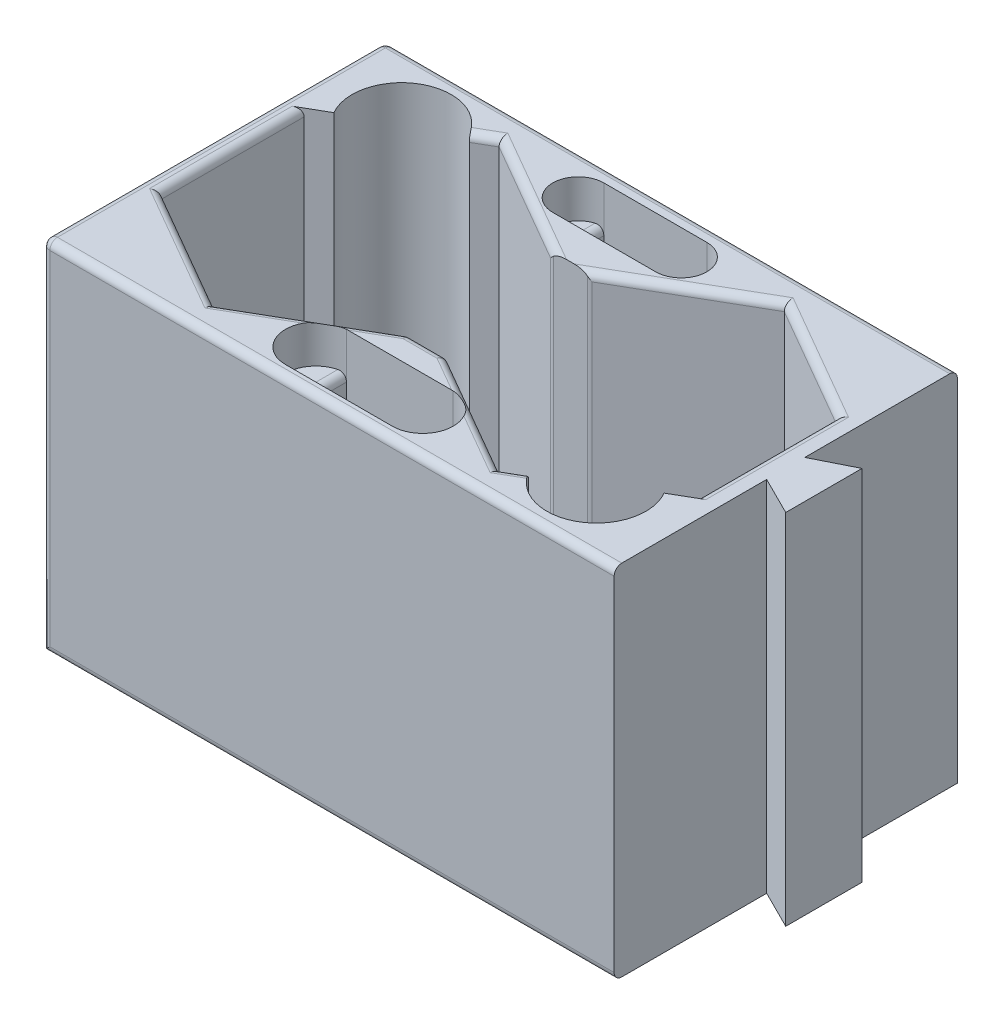
from build123d import *

# Parameters (mm, degrees)
BOSS_EXTRUDE1_DEPTH = 119.38
CUT_EXTRUDE1_DEPTH  = 115.57
SKETCH3_W           = 34.29
SKETCH3_H           = 17.018
CUT_EXTRUDE2_DEPTH  = 20.32
SKETCH4_W           = 35.56
SKETCH4_H           = 20.32
CUT_EXTRUDE3_DEPTH  = 35.56
CUT_EXTRUDE4_DEPTH  = 12.7
FILLET1_R           = 2.54
FILLET2_R           = 2.54


with BuildPart() as part:
    # Sketch1 → Boss-Extrude1 (new body)
    with BuildSketch(Plane(origin=(0, 0, 0), x_dir=(1, 0, 0), z_dir=(0, 1, 0))):
        Polygon((190.5, 63.5), (203.2, 69.85), (203.2, 44.45), (190.5, 50.8), (190.5, 0), (0, 0), (0, 114.3), (190.5, 114.3), align=None)
    extrude(amount=BOSS_EXTRUDE1_DEPTH)

    # Sketch2 → Cut-Extrude1 (cut)
    with BuildSketch(Plane(origin=(0, 119.38, 0), x_dir=(1, 0, 0), z_dir=(0, 1, 0))):
        with BuildLine():
            Line((47.498, 9.636382247), (88.646, 33.393191123))
            Line((88.646, 33.393191123), (101.346, 33.393191123))
            Line((101.346, 33.393191123), (142.494, 9.636382247))
            Line((142.494, 9.636382247), (148.769920584, 13.259786685))
            ThreePointArc((148.769920584, 13.259786685), (171.323, 7.216707269), (177.366079416, 29.769786685))
            Line((177.366079416, 29.769786685), (183.642, 33.393191123))
            Line((183.642, 33.393191123), (183.642, 80.906808877))
            Line((183.642, 80.906808877), (177.366079416, 84.530213315))
            Line((177.366079416, 84.530213315), (148.769920584, 101.040213315))
            Line((148.769920584, 101.040213315), (142.494, 104.663617753))
            Line((142.494, 104.663617753), (101.346, 80.906808877))
            Line((101.346, 80.906808877), (88.646, 80.906808877))
            Line((88.646, 80.906808877), (47.498, 104.663617753))
            Line((47.498, 104.663617753), (41.222079416, 101.040213315))
            ThreePointArc((41.222079416, 101.040213315), (18.669, 107.083292731), (12.625920584, 84.530213315))
            Line((12.625920584, 84.530213315), (6.35, 80.906808877))
            Line((6.35, 80.906808877), (6.35, 33.393191123))
            Line((6.35, 33.393191123), (12.625920584, 29.769786685))
            Line((12.625920584, 29.769786685), (41.222079416, 13.259786685))
            Line((41.222079416, 13.259786685), (47.498, 9.636382247))
        make_face()
    extrude(amount=-CUT_EXTRUDE1_DEPTH, mode=Mode.SUBTRACT)

    # Sketch3 → Cut-Extrude2 (cut)
    with BuildSketch(Plane(origin=(0, 119.38, 0), x_dir=(1, 0, 0), z_dir=(0, 1, 0))):
        with Locations((94.996, 100.711)):
            Rectangle(SKETCH3_W, SKETCH3_H)
    extrude(amount=-CUT_EXTRUDE2_DEPTH, mode=Mode.SUBTRACT)

    # Sketch4 → Cut-Extrude3 (cut)
    with BuildSketch(Plane(origin=(0, 119.38, 0), x_dir=(1, 0, 0), z_dir=(0, 1, 0))):
        with Locations((94.996, 13.97)):
            Rectangle(SKETCH4_W, SKETCH4_H)
    extrude(amount=-CUT_EXTRUDE3_DEPTH, mode=Mode.SUBTRACT)

    # Sketch5 → Cut-Extrude4 (cut)
    with BuildSketch(Plane(origin=(0, 119.38, 0), x_dir=(1, 0, 0), z_dir=(0, 1, 0))):
        with BuildLine():
            Line((77.851, 109.22), (77.851, 92.202))
            ThreePointArc((77.851, 92.202), (69.342, 100.711), (77.851, 109.22))
        make_face()
        with BuildLine():
            Line((112.141, 109.22), (112.141, 92.202))
            ThreePointArc((112.141, 92.202), (120.65, 100.711), (112.141, 109.22))
        make_face()
        with BuildLine():
            Line((112.776, 24.13), (112.776, 3.81))
            ThreePointArc((112.776, 3.81), (122.936, 13.97), (112.776, 24.13))
        make_face()
        with BuildLine():
            Line((77.216, 24.13), (77.216, 3.81))
            ThreePointArc((77.216, 3.81), (67.056, 13.97), (77.216, 24.13))
        make_face()
    extrude(amount=-CUT_EXTRUDE4_DEPTH, mode=Mode.SUBTRACT)

    # Fillet1
    fillet1_edges = [part.edges().sort_by_distance(p)[0] for p in [
        (95.25, 0, 0),
        (0, 59.69, -114.3),
        (0, 59.69, 0),
        (95.25, 119.38, -114.3),
        (0, 119.38, -57.15),
        (95.25, 119.38, 0),
    ]]
    fillet(fillet1_edges, radius=FILLET1_R)

    # Fillet2
    # the kernel refuses this fillet: 2.54 mm, written as the material it takes off along each edge
    with BuildSketch(Plane(origin=(100.665409051, 116.84, -30.853191123), x_dir=(0, 0, -1), z_dir=(0, 1, 0))) as fillet2_piece_1_section:
        Polygon((0, 0), (FILLET2_R * 1.02, 0), (FILLET2_R * 1.02, -FILLET2_R * 0.27330817628), (FILLET2_R * 0.88334591186, -FILLET2_R * 0.51), align=None)
    fillet2_piece_1 = extrude(amount=FILLET2_R * 1.02, mode=Mode.PRIVATE)
    fillet2_piece_1 = fillet2_piece_1 - Plane(origin=(100.665409051, 116.84, -30.853191123), x_dir=(-0.25881904510252135, 0, 0.9659258262890681), z_dir=(0, 1, 0)) * Sphere(FILLET2_R, mode=Mode.PRIVATE)
    add(fillet2_piece_1, mode=Mode.SUBTRACT)
    with BuildSketch(Plane(origin=(89.326590949, 116.84, -30.853191123), x_dir=(-0.4999999999999999, 0, -0.8660254037844388), z_dir=(0, 1, 0))) as fillet2_piece_2_section:
        Polygon((0, 0), (FILLET2_R * 1.02, 0), (FILLET2_R * 1.02, -FILLET2_R * 0.27330817628), (FILLET2_R * 0.88334591186, -FILLET2_R * 0.51), align=None)
    fillet2_piece_2 = extrude(amount=FILLET2_R * 1.02, mode=Mode.PRIVATE)
    fillet2_piece_2 = fillet2_piece_2 - Plane(origin=(89.326590949, 116.84, -30.853191123), x_dir=(0.25881904510252013, 0, 0.9659258262890684), z_dir=(0, 1, 0)) * Sphere(FILLET2_R, mode=Mode.PRIVATE)
    add(fillet2_piece_2, mode=Mode.SUBTRACT)
    with BuildSketch(Plane(origin=(112.141, 106.68, -109.22), x_dir=(0, -1, 0), z_dir=(0, 0, 1))) as fillet2_piece_3_section:
        with BuildLine():
            CenterArc((FILLET2_R, FILLET2_R), FILLET2_R, 180, 90)
            Line((0, FILLET2_R), (-FILLET2_R * 0.02, FILLET2_R))
            Line((-FILLET2_R * 0.02, FILLET2_R), (-FILLET2_R * 0.02, -FILLET2_R * 0.02))
            Line((-FILLET2_R * 0.02, -FILLET2_R * 0.02), (FILLET2_R, -FILLET2_R * 0.02))
            Line((FILLET2_R, -FILLET2_R * 0.02), (FILLET2_R, 0))
        make_face()
    fillet2_piece_3 = extrude(amount=17.018, mode=Mode.PRIVATE)
    fillet2_piece_3 = fillet2_piece_3 & Plane(origin=(112.141, 106.103099733, -100.711), x_dir=(0, 0, 1), z_dir=(0, 1, 0)) * Cylinder(8.509, 45, mode=Mode.PRIVATE)
    add(fillet2_piece_3, mode=Mode.SUBTRACT)
    with BuildSketch(Plane(origin=(77.851, 106.68, -109.22), x_dir=(0, -1, 0), z_dir=(0, 0, 1))) as fillet2_piece_4_section:
        with BuildLine():
            CenterArc((FILLET2_R, -FILLET2_R), FILLET2_R, 90, 90)
            Line((0, -FILLET2_R), (-FILLET2_R * 0.02, -FILLET2_R))
            Line((-FILLET2_R * 0.02, -FILLET2_R), (-FILLET2_R * 0.02, FILLET2_R * 0.02))
            Line((-FILLET2_R * 0.02, FILLET2_R * 0.02), (FILLET2_R, FILLET2_R * 0.02))
            Line((FILLET2_R, FILLET2_R * 0.02), (FILLET2_R, 0))
        make_face()
    fillet2_piece_4 = extrude(amount=17.018, mode=Mode.PRIVATE)
    fillet2_piece_4 = fillet2_piece_4 & Plane(origin=(77.851, 106.103100911, -100.711), x_dir=(0, 0, 1), z_dir=(0, 1, 0)) * Cylinder(8.509, 45, mode=Mode.PRIVATE)
    add(fillet2_piece_4, mode=Mode.SUBTRACT)
    with BuildSketch(Plane(origin=(112.776, 106.68, -24.13), x_dir=(0, -1, 0), z_dir=(0, 0, 1))) as fillet2_piece_5_section:
        with BuildLine():
            CenterArc((FILLET2_R, FILLET2_R), FILLET2_R, 180, 90)
            Line((0, FILLET2_R), (-FILLET2_R * 0.02, FILLET2_R))
            Line((-FILLET2_R * 0.02, FILLET2_R), (-FILLET2_R * 0.02, -FILLET2_R * 0.02))
            Line((-FILLET2_R * 0.02, -FILLET2_R * 0.02), (FILLET2_R, -FILLET2_R * 0.02))
            Line((FILLET2_R, -FILLET2_R * 0.02), (FILLET2_R, 0))
        make_face()
    fillet2_piece_5 = extrude(amount=20.32, mode=Mode.PRIVATE)
    fillet2_piece_5 = fillet2_piece_5 & Plane(origin=(112.776, 106.103660452, -13.97), x_dir=(0, 0, 1), z_dir=(0, 1, 0)) * Cylinder(10.16, 51, mode=Mode.PRIVATE)
    add(fillet2_piece_5, mode=Mode.SUBTRACT)
    with BuildSketch(Plane(origin=(77.216, 106.68, -24.13), x_dir=(0, -1, 0), z_dir=(0, 0, 1))) as fillet2_piece_6_section:
        with BuildLine():
            CenterArc((FILLET2_R, -FILLET2_R), FILLET2_R, 90, 90)
            Line((0, -FILLET2_R), (-FILLET2_R * 0.02, -FILLET2_R))
            Line((-FILLET2_R * 0.02, -FILLET2_R), (-FILLET2_R * 0.02, FILLET2_R * 0.02))
            Line((-FILLET2_R * 0.02, FILLET2_R * 0.02), (FILLET2_R, FILLET2_R * 0.02))
            Line((FILLET2_R, FILLET2_R * 0.02), (FILLET2_R, 0))
        make_face()
    fillet2_piece_6 = extrude(amount=20.32, mode=Mode.PRIVATE)
    fillet2_piece_6 = fillet2_piece_6 & Plane(origin=(77.216, 106.103659983, -13.97), x_dir=(0, 0, 1), z_dir=(0, 1, 0)) * Cylinder(10.16, 51, mode=Mode.PRIVATE)
    add(fillet2_piece_6, mode=Mode.SUBTRACT)
    with BuildSketch(Plane(origin=(147.993261314, 119.38, -107.838617753), x_dir=(-0.5000000000000036, 0, -0.8660254037844366), z_dir=(-0.8660254037844366, 0, 0.5000000000000036))) as fillet2_piece_7_section:
        with BuildLine():
            CenterArc((FILLET2_R, FILLET2_R), FILLET2_R, 180, 90)
            Line((0, FILLET2_R), (-FILLET2_R * 0.02, FILLET2_R))
            Line((-FILLET2_R * 0.02, FILLET2_R), (-FILLET2_R * 0.02, -FILLET2_R * 0.02))
            Line((-FILLET2_R * 0.02, -FILLET2_R * 0.02), (FILLET2_R, -FILLET2_R * 0.02))
            Line((FILLET2_R, -FILLET2_R * 0.02), (FILLET2_R, 0))
        make_face()
    fillet2_piece_7 = extrude(amount=60.213617753, mode=Mode.PRIVATE)
    fillet2_piece_7 = split(fillet2_piece_7, bisect_by=Plane(origin=(121.046654649, 118.809202018, -80.906808877), z_dir=(0, 0, -1)), keep=Keep.TOP, mode=Mode.PRIVATE)
    fillet2_piece_7 = split(fillet2_piece_7, bisect_by=Plane(origin=(131.479212207, 118.809202018, -111.02300845), z_dir=(-0.4999999999999996, 0, 0.8660254037844389)), keep=Keep.TOP, mode=Mode.PRIVATE)
    add(fillet2_piece_7, mode=Mode.SUBTRACT)
    with BuildSketch(Plane(origin=(136.994738686, 119.38, -107.838617753), x_dir=(0.49999999999999833, 0, -0.8660254037844396), z_dir=(0.8660254037844396, 0, 0.49999999999999833))) as fillet2_piece_8_section:
        with BuildLine():
            CenterArc((FILLET2_R, -FILLET2_R), FILLET2_R, 90, 90)
            Line((0, -FILLET2_R), (-FILLET2_R * 0.02, -FILLET2_R))
            Line((-FILLET2_R * 0.02, -FILLET2_R), (-FILLET2_R * 0.02, FILLET2_R * 0.02))
            Line((-FILLET2_R * 0.02, FILLET2_R * 0.02), (FILLET2_R, FILLET2_R * 0.02))
            Line((FILLET2_R, FILLET2_R * 0.02), (FILLET2_R, 0))
        make_face()
    fillet2_piece_8 = extrude(amount=60.213617753, mode=Mode.PRIVATE)
    fillet2_piece_8 = split(fillet2_piece_8, bisect_by=Plane(origin=(183.642, 118.800590454, -93.276815435), z_dir=(-1, 0, 0)), keep=Keep.TOP, mode=Mode.PRIVATE)
    fillet2_piece_8 = split(fillet2_piece_8, bisect_by=Plane(origin=(153.206739924, 118.800590454, -110.848621032), z_dir=(0.5000000000000036, 0, 0.8660254037844366)), keep=Keep.TOP, mode=Mode.PRIVATE)
    add(fillet2_piece_8, mode=Mode.SUBTRACT)
    with BuildSketch(Plane(origin=(183.642, 119.38, -27.043191123), x_dir=(1, 0, 0), z_dir=(0, 0, -1))) as fillet2_piece_9_section:
        with BuildLine():
            CenterArc((FILLET2_R, FILLET2_R), FILLET2_R, 180, 90)
            Line((0, FILLET2_R), (-FILLET2_R * 0.02, FILLET2_R))
            Line((-FILLET2_R * 0.02, FILLET2_R), (-FILLET2_R * 0.02, -FILLET2_R * 0.02))
            Line((-FILLET2_R * 0.02, -FILLET2_R * 0.02), (FILLET2_R, -FILLET2_R * 0.02))
            Line((FILLET2_R, -FILLET2_R * 0.02), (FILLET2_R, 0))
        make_face()
    fillet2_piece_9 = extrude(amount=60.213617753, mode=Mode.PRIVATE)
    fillet2_piece_9 = split(fillet2_piece_9, bisect_by=Plane(origin=(194.354739924, 118.800590454, -39.578194402), z_dir=(-0.5000000000000037, 0, -0.8660254037844366)), keep=Keep.TOP, mode=Mode.PRIVATE)
    fillet2_piece_9 = split(fillet2_piece_9, bisect_by=Plane(origin=(194.354739924, 118.800590454, -74.721805598), z_dir=(-0.4999999999999996, 0, 0.8660254037844389)), keep=Keep.TOP, mode=Mode.PRIVATE)
    add(fillet2_piece_9, mode=Mode.SUBTRACT)
    with BuildSketch(Plane(origin=(136.994738686, 119.38, -6.461382247), x_dir=(0.5000000000000201, 0, 0.866025403784427), z_dir=(0.866025403784427, 0, -0.5000000000000202))) as fillet2_piece_10_section:
        with BuildLine():
            CenterArc((FILLET2_R, FILLET2_R), FILLET2_R, 180, 90)
            Line((0, FILLET2_R), (-FILLET2_R * 0.02, FILLET2_R))
            Line((-FILLET2_R * 0.02, FILLET2_R), (-FILLET2_R * 0.02, -FILLET2_R * 0.02))
            Line((-FILLET2_R * 0.02, -FILLET2_R * 0.02), (FILLET2_R, -FILLET2_R * 0.02))
            Line((FILLET2_R, -FILLET2_R * 0.02), (FILLET2_R, 0))
        make_face()
    fillet2_piece_10 = extrude(amount=19.946808877, mode=Mode.PRIVATE)
    fillet2_piece_10 = fillet2_piece_10 - Plane(origin=(163.068, 118.791367162, -21.514786685), x_dir=(-0.8660254037844459, 0, 0.4999999999999873), z_dir=(0, 1, 0)) * Cylinder(16.51, 51, mode=Mode.PRIVATE)
    fillet2_piece_10 = split(fillet2_piece_10, bisect_by=Plane(origin=(144.550211908, 118.791367162, -8.449227748), z_dir=(0.5000000000000001, 0, -0.8660254037844386)), keep=Keep.TOP, mode=Mode.PRIVATE)
    add(fillet2_piece_10, mode=Mode.SUBTRACT)
    with BuildSketch(Plane(origin=(101.935409051, 119.38, -33.052895649), x_dir=(-0.5000000000000002, 0, 0.8660254037844385), z_dir=(0.8660254037844386, 0, 0.5000000000000001))) as fillet2_piece_11_section:
        with BuildLine():
            CenterArc((FILLET2_R, FILLET2_R), FILLET2_R, 180, 90)
            Line((0, FILLET2_R), (-FILLET2_R * 0.02, FILLET2_R))
            Line((-FILLET2_R * 0.02, FILLET2_R), (-FILLET2_R * 0.02, -FILLET2_R * 0.02))
            Line((-FILLET2_R * 0.02, -FILLET2_R * 0.02), (FILLET2_R, -FILLET2_R * 0.02))
            Line((FILLET2_R, -FILLET2_R * 0.02), (FILLET2_R, 0))
        make_face()
    fillet2_piece_11 = extrude(amount=53.183026804, mode=Mode.PRIVATE)
    fillet2_piece_11 = split(fillet2_piece_11, bisect_by=Plane(origin=(131.854446641, 118.802757068, -3.493633251), z_dir=(-0.5000000000000202, 0, -0.866025403784427)), keep=Keep.TOP, mode=Mode.PRIVATE)
    add(fillet2_piece_11, mode=Mode.SUBTRACT)
    with BuildSketch(Plane(origin=(89.326590949, 119.38, -33.393191123), x_dir=(0, 0, 1), z_dir=(1, 0, 0))) as fillet2_piece_12:
        with BuildLine():
            CenterArc((FILLET2_R, FILLET2_R), FILLET2_R, 180, 90)
            Line((0, FILLET2_R), (-FILLET2_R * 0.02, FILLET2_R))
            Line((-FILLET2_R * 0.02, FILLET2_R), (-FILLET2_R * 0.02, -FILLET2_R * 0.02))
            Line((-FILLET2_R * 0.02, -FILLET2_R * 0.02), (FILLET2_R, -FILLET2_R * 0.02))
            Line((FILLET2_R, -FILLET2_R * 0.02), (FILLET2_R, 0))
        make_face()
    extrude(amount=11.338818102, mode=Mode.SUBTRACT)
    with BuildSketch(Plane(origin=(41.998738686, 119.38, -6.461382247), x_dir=(0.4999999999999999, 0, 0.8660254037844387), z_dir=(0.8660254037844388, 0, -0.4999999999999999))) as fillet2_piece_13_section:
        with BuildLine():
            CenterArc((FILLET2_R, FILLET2_R), FILLET2_R, 180, 90)
            Line((0, FILLET2_R), (-FILLET2_R * 0.02, FILLET2_R))
            Line((-FILLET2_R * 0.02, FILLET2_R), (-FILLET2_R * 0.02, -FILLET2_R * 0.02))
            Line((-FILLET2_R * 0.02, -FILLET2_R * 0.02), (FILLET2_R, -FILLET2_R * 0.02))
            Line((FILLET2_R, -FILLET2_R * 0.02), (FILLET2_R, 0))
        make_face()
    fillet2_piece_13 = extrude(amount=53.183026804, mode=Mode.PRIVATE)
    fillet2_piece_13 = split(fillet2_piece_13, bisect_by=Plane(origin=(58.137553359, 118.802757068, -3.493633251), z_dir=(0.5000000000000004, 0, -0.8660254037844384)), keep=Keep.TOP, mode=Mode.PRIVATE)
    add(fillet2_piece_13, mode=Mode.SUBTRACT)
    with BuildSketch(Plane(origin=(52.997261314, 119.38, -6.461382247), x_dir=(-0.5000000000000001, 0, 0.8660254037844386), z_dir=(-0.8660254037844386, 0, -0.5000000000000001))) as fillet2_piece_14_section:
        with BuildLine():
            CenterArc((FILLET2_R, -FILLET2_R), FILLET2_R, 90, 90)
            Line((0, -FILLET2_R), (-FILLET2_R * 0.02, -FILLET2_R))
            Line((-FILLET2_R * 0.02, -FILLET2_R), (-FILLET2_R * 0.02, FILLET2_R * 0.02))
            Line((-FILLET2_R * 0.02, FILLET2_R * 0.02), (FILLET2_R, FILLET2_R * 0.02))
            Line((FILLET2_R, FILLET2_R * 0.02), (FILLET2_R, 0))
        make_face()
    fillet2_piece_14 = extrude(amount=60.213617753, mode=Mode.PRIVATE)
    fillet2_piece_14 = split(fillet2_piece_14, bisect_by=Plane(origin=(6.35, 118.800590454, -21.023184565), z_dir=(1, 0, 0)), keep=Keep.TOP, mode=Mode.PRIVATE)
    fillet2_piece_14 = split(fillet2_piece_14, bisect_by=Plane(origin=(36.785260076, 118.800590454, -3.451378968), z_dir=(-0.4999999999999999, 0, -0.8660254037844388)), keep=Keep.TOP, mode=Mode.PRIVATE)
    add(fillet2_piece_14, mode=Mode.SUBTRACT)
    with BuildSketch(Plane(origin=(6.35, 119.38, -87.256808877), x_dir=(-1, 0, 0), z_dir=(0, 0, 1))) as fillet2_piece_15_section:
        with BuildLine():
            CenterArc((FILLET2_R, FILLET2_R), FILLET2_R, 180, 90)
            Line((0, FILLET2_R), (-FILLET2_R * 0.02, FILLET2_R))
            Line((-FILLET2_R * 0.02, FILLET2_R), (-FILLET2_R * 0.02, -FILLET2_R * 0.02))
            Line((-FILLET2_R * 0.02, -FILLET2_R * 0.02), (FILLET2_R, -FILLET2_R * 0.02))
            Line((FILLET2_R, -FILLET2_R * 0.02), (FILLET2_R, 0))
        make_face()
    fillet2_piece_15 = extrude(amount=60.213617753, mode=Mode.PRIVATE)
    fillet2_piece_15 = split(fillet2_piece_15, bisect_by=Plane(origin=(-4.362739924, 118.800590454, -74.721805598), z_dir=(0.5, 0, 0.8660254037844387)), keep=Keep.TOP, mode=Mode.PRIVATE)
    fillet2_piece_15 = split(fillet2_piece_15, bisect_by=Plane(origin=(-4.362739924, 118.800590454, -39.578194402), z_dir=(0.5000000000000004, 0, -0.8660254037844384)), keep=Keep.TOP, mode=Mode.PRIVATE)
    add(fillet2_piece_15, mode=Mode.SUBTRACT)
    with BuildSketch(Plane(origin=(52.997261314, 119.38, -107.838617753), x_dir=(-0.49999999999999983, 0, -0.8660254037844387), z_dir=(-0.8660254037844388, 0, 0.4999999999999999))) as fillet2_piece_16_section:
        with BuildLine():
            CenterArc((FILLET2_R, FILLET2_R), FILLET2_R, 180, 90)
            Line((0, FILLET2_R), (-FILLET2_R * 0.02, FILLET2_R))
            Line((-FILLET2_R * 0.02, FILLET2_R), (-FILLET2_R * 0.02, -FILLET2_R * 0.02))
            Line((-FILLET2_R * 0.02, -FILLET2_R * 0.02), (FILLET2_R, -FILLET2_R * 0.02))
            Line((FILLET2_R, -FILLET2_R * 0.02), (FILLET2_R, 0))
        make_face()
    fillet2_piece_16 = extrude(amount=19.946808877, mode=Mode.PRIVATE)
    fillet2_piece_16 = fillet2_piece_16 - Plane(origin=(26.924, 118.791365396, -92.785213315), x_dir=(0.8660254037844385, 0, -0.5000000000000003), z_dir=(0, 1, 0)) * Cylinder(16.51, 51, mode=Mode.PRIVATE)
    fillet2_piece_16 = split(fillet2_piece_16, bisect_by=Plane(origin=(45.441780291, 118.791365396, -105.850776755), z_dir=(-0.4999999999999998, 0, 0.8660254037844388)), keep=Keep.TOP, mode=Mode.PRIVATE)
    add(fillet2_piece_16, mode=Mode.SUBTRACT)
    with BuildSketch(Plane(origin=(94.145261314, 119.38, -77.731808877), x_dir=(0.49999999999999967, 0, -0.8660254037844387), z_dir=(-0.8660254037844388, 0, -0.4999999999999998))) as fillet2_piece_17_section:
        with BuildLine():
            CenterArc((FILLET2_R, FILLET2_R), FILLET2_R, 180, 90)
            Line((0, FILLET2_R), (-FILLET2_R * 0.02, FILLET2_R))
            Line((-FILLET2_R * 0.02, FILLET2_R), (-FILLET2_R * 0.02, -FILLET2_R * 0.02))
            Line((-FILLET2_R * 0.02, -FILLET2_R * 0.02), (FILLET2_R, -FILLET2_R * 0.02))
            Line((FILLET2_R, -FILLET2_R * 0.02), (FILLET2_R, 0))
        make_face()
    fillet2_piece_17 = extrude(amount=60.213617753, mode=Mode.PRIVATE)
    fillet2_piece_17 = split(fillet2_piece_17, bisect_by=Plane(origin=(68.945345351, 118.809202018, -80.906808877), z_dir=(0, 0, -1)), keep=Keep.TOP, mode=Mode.PRIVATE)
    fillet2_piece_17 = split(fillet2_piece_17, bisect_by=Plane(origin=(58.512787793, 118.809202018, -111.02300845), z_dir=(0.4999999999999999, 0, 0.8660254037844388)), keep=Keep.TOP, mode=Mode.PRIVATE)
    add(fillet2_piece_17, mode=Mode.SUBTRACT)
    with BuildSketch(Plane(origin=(88.646, 116.84, -33.393191123), x_dir=(-0.8660254037844387, 0, 0.4999999999999998), z_dir=(0, -1, 0)), Plane(origin=(101.346, 116.84, -33.393191123), x_dir=(-1, 0, 0), z_dir=(0, -1, 0))) as fillet2_piece_18:
        with BuildLine():
            CenterArc((FILLET2_R * 0.267949192431, -FILLET2_R), FILLET2_R, 90, 30)
            Line((-FILLET2_R * 0.232050807569, -FILLET2_R * 0.133974596216), (-FILLET2_R * 0.242050807569, -FILLET2_R * 0.11665408814))
            Line((-FILLET2_R * 0.242050807569, -FILLET2_R * 0.11665408814), (-FILLET2_R * 0.00535898384862, FILLET2_R * 0.02))
            Line((-FILLET2_R * 0.00535898384862, FILLET2_R * 0.02), (FILLET2_R * 0.267949192431, FILLET2_R * 0.02))
            Line((FILLET2_R * 0.267949192431, FILLET2_R * 0.02), (FILLET2_R * 0.267949192431, 0))
        make_face()
    extrude(amount=113.03, mode=Mode.SUBTRACT)
    with BuildSketch(Plane(origin=(88.646, 119.38, -80.906808877), x_dir=(-0.8660254037844364, 0, -0.500000000000004), z_dir=(0, -1, 0)), Plane(origin=(101.346, 119.38, -80.906808877), x_dir=(-1, 0, 0), z_dir=(0, -1, 0))) as fillet2_piece_19:
        with BuildLine():
            CenterArc((FILLET2_R * 0.267949192431, FILLET2_R), FILLET2_R, 240, 30)
            Line((-FILLET2_R * 0.232050807569, FILLET2_R * 0.133974596216), (-FILLET2_R * 0.242050807569, FILLET2_R * 0.11665408814))
            Line((-FILLET2_R * 0.242050807569, FILLET2_R * 0.11665408814), (-FILLET2_R * 0.00535898384862, -FILLET2_R * 0.02))
            Line((-FILLET2_R * 0.00535898384862, -FILLET2_R * 0.02), (FILLET2_R * 0.267949192431, -FILLET2_R * 0.02))
            Line((FILLET2_R * 0.267949192431, -FILLET2_R * 0.02), (FILLET2_R * 0.267949192431, 0))
        make_face()
    extrude(amount=115.57, mode=Mode.SUBTRACT)
    with BuildSketch(Plane(origin=(147.993261314, 119.38, -107.838617753), x_dir=(-0.5000000000000036, 0, -0.8660254037844366), z_dir=(-0.8660254037844366, 0, 0.5000000000000036))) as fillet2_piece_20a_section:
        with BuildLine():
            CenterArc((FILLET2_R, FILLET2_R), FILLET2_R, 180, 90)
            Line((0, FILLET2_R), (-FILLET2_R * 0.02, FILLET2_R))
            Line((-FILLET2_R * 0.02, FILLET2_R), (-FILLET2_R * 0.02, -FILLET2_R * 0.02))
            Line((-FILLET2_R * 0.02, -FILLET2_R * 0.02), (FILLET2_R, -FILLET2_R * 0.02))
            Line((FILLET2_R, -FILLET2_R * 0.02), (FILLET2_R, 0))
        make_face()
    fillet2_piece_20a = extrude(amount=60.213617753, mode=Mode.PRIVATE)
    fillet2_piece_20a = split(fillet2_piece_20a, bisect_by=Plane(origin=(143.342982634, 118.820261953, -104.173457401), z_dir=(0.4999999999999996, 0, -0.8660254037844389)), keep=Keep.TOP, mode=Mode.PRIVATE)
    with BuildSketch(Plane(origin=(136.994738686, 119.38, -107.838617753), x_dir=(0.49999999999999833, 0, -0.8660254037844396), z_dir=(0.8660254037844396, 0, 0.49999999999999833))) as fillet2_piece_20b_section:
        with BuildLine():
            CenterArc((FILLET2_R, -FILLET2_R), FILLET2_R, 90, 90)
            Line((0, -FILLET2_R), (-FILLET2_R * 0.02, -FILLET2_R))
            Line((-FILLET2_R * 0.02, -FILLET2_R), (-FILLET2_R * 0.02, FILLET2_R * 0.02))
            Line((-FILLET2_R * 0.02, FILLET2_R * 0.02), (FILLET2_R, FILLET2_R * 0.02))
            Line((FILLET2_R, FILLET2_R * 0.02), (FILLET2_R, 0))
        make_face()
    fillet2_piece_20b = extrude(amount=60.213617753, mode=Mode.PRIVATE)
    fillet2_piece_20b = split(fillet2_piece_20b, bisect_by=Plane(origin=(141.645017366, 118.820261953, -104.173457401), z_dir=(-0.5000000000000036, 0, -0.8660254037844366)), keep=Keep.TOP, mode=Mode.PRIVATE)
    fillet2_piece_20 = fillet2_piece_20a & fillet2_piece_20b
    add(fillet2_piece_20, mode=Mode.SUBTRACT)
    with BuildSketch(Plane(origin=(147.993261314, 119.38, -107.838617753), x_dir=(-0.5000000000000036, 0, -0.8660254037844366), z_dir=(-0.8660254037844366, 0, 0.5000000000000036))) as fillet2_piece_21a_section:
        with BuildLine():
            CenterArc((FILLET2_R, FILLET2_R), FILLET2_R, 180, 90)
            Line((0, FILLET2_R), (-FILLET2_R * 0.02, FILLET2_R))
            Line((-FILLET2_R * 0.02, FILLET2_R), (-FILLET2_R * 0.02, -FILLET2_R * 0.02))
            Line((-FILLET2_R * 0.02, -FILLET2_R * 0.02), (FILLET2_R, -FILLET2_R * 0.02))
            Line((FILLET2_R, -FILLET2_R * 0.02), (FILLET2_R, 0))
        make_face()
    fillet2_piece_21a = extrude(amount=60.213617753, mode=Mode.PRIVATE)
    fillet2_piece_21a = split(fillet2_piece_21a, bisect_by=Plane(origin=(97.998818493, 118.74765061, -80.906808877), z_dir=(0, 0, 1)), keep=Keep.TOP, mode=Mode.PRIVATE)
    with BuildSketch(Plane(origin=(101.346, 121.081477372, -80.906808877), x_dir=(-1, 0, 0), z_dir=(0, -1, 0))) as fillet2_piece_21b_section:
        with BuildLine():
            CenterArc((FILLET2_R * 0.267949192431, FILLET2_R), FILLET2_R, 240, 30)
            Line((-FILLET2_R * 0.232050807569, FILLET2_R * 0.133974596216), (-FILLET2_R * 0.242050807569, FILLET2_R * 0.11665408814))
            Line((-FILLET2_R * 0.242050807569, FILLET2_R * 0.11665408814), (-FILLET2_R * 0.00535898384862, -FILLET2_R * 0.02))
            Line((-FILLET2_R * 0.00535898384862, -FILLET2_R * 0.02), (FILLET2_R * 0.267949192431, -FILLET2_R * 0.02))
            Line((FILLET2_R * 0.267949192431, -FILLET2_R * 0.02), (FILLET2_R * 0.267949192431, 0))
        make_face()
    fillet2_piece_21b = extrude(amount=117.271477372, mode=Mode.PRIVATE)
    fillet2_piece_21b = split(fillet2_piece_21b, bisect_by=Plane(origin=(101.328986456, 119.38, -80.970304289), z_dir=(0, 1, 0)), keep=Keep.TOP, mode=Mode.PRIVATE)
    fillet2_piece_21 = fillet2_piece_21a & fillet2_piece_21b
    add(fillet2_piece_21, mode=Mode.SUBTRACT)
    with BuildSketch(Plane(origin=(183.642, 119.38, -27.043191123), x_dir=(1, 0, 0), z_dir=(0, 0, -1))) as fillet2_piece_22a_section:
        with BuildLine():
            CenterArc((FILLET2_R, FILLET2_R), FILLET2_R, 180, 90)
            Line((0, FILLET2_R), (-FILLET2_R * 0.02, FILLET2_R))
            Line((-FILLET2_R * 0.02, FILLET2_R), (-FILLET2_R * 0.02, -FILLET2_R * 0.02))
            Line((-FILLET2_R * 0.02, -FILLET2_R * 0.02), (FILLET2_R, -FILLET2_R * 0.02))
            Line((FILLET2_R, -FILLET2_R * 0.02), (FILLET2_R, 0))
        make_face()
    fillet2_piece_22a = extrude(amount=60.213617753, mode=Mode.PRIVATE)
    fillet2_piece_22a = split(fillet2_piece_22a, bisect_by=Plane(origin=(182.793017366, 118.820261953, -81.396969229), z_dir=(0.4999999999999996, 0, -0.8660254037844389)), keep=Keep.TOP, mode=Mode.PRIVATE)
    with BuildSketch(Plane(origin=(136.994738686, 119.38, -107.838617753), x_dir=(0.49999999999999833, 0, -0.8660254037844396), z_dir=(0.8660254037844396, 0, 0.49999999999999833))) as fillet2_piece_22b_section:
        with BuildLine():
            CenterArc((FILLET2_R, -FILLET2_R), FILLET2_R, 90, 90)
            Line((0, -FILLET2_R), (-FILLET2_R * 0.02, -FILLET2_R))
            Line((-FILLET2_R * 0.02, -FILLET2_R), (-FILLET2_R * 0.02, FILLET2_R * 0.02))
            Line((-FILLET2_R * 0.02, FILLET2_R * 0.02), (FILLET2_R, FILLET2_R * 0.02))
            Line((FILLET2_R, FILLET2_R * 0.02), (FILLET2_R, 0))
        make_face()
    fillet2_piece_22b = extrude(amount=60.213617753, mode=Mode.PRIVATE)
    fillet2_piece_22b = split(fillet2_piece_22b, bisect_by=Plane(origin=(183.642, 118.820261953, -79.926488173), z_dir=(1, 0, 0)), keep=Keep.TOP, mode=Mode.PRIVATE)
    fillet2_piece_22 = fillet2_piece_22a & fillet2_piece_22b
    add(fillet2_piece_22, mode=Mode.SUBTRACT)
    with BuildSketch(Plane(origin=(101.935409051, 119.38, -33.052895649), x_dir=(-0.5000000000000002, 0, 0.8660254037844385), z_dir=(0.8660254037844386, 0, 0.5000000000000001))) as fillet2_piece_23a_section:
        with BuildLine():
            CenterArc((FILLET2_R, FILLET2_R), FILLET2_R, 180, 90)
            Line((0, FILLET2_R), (-FILLET2_R * 0.02, FILLET2_R))
            Line((-FILLET2_R * 0.02, FILLET2_R), (-FILLET2_R * 0.02, -FILLET2_R * 0.02))
            Line((-FILLET2_R * 0.02, -FILLET2_R * 0.02), (FILLET2_R, -FILLET2_R * 0.02))
            Line((FILLET2_R, -FILLET2_R * 0.02), (FILLET2_R, 0))
        make_face()
    fillet2_piece_23a = extrude(amount=53.183026804, mode=Mode.PRIVATE)
    fillet2_piece_23a = split(fillet2_piece_23a, bisect_by=Plane(origin=(143.342982634, 118.820261953, -10.126542599), z_dir=(0.5000000000000202, 0, 0.866025403784427)), keep=Keep.TOP, mode=Mode.PRIVATE)
    with BuildSketch(Plane(origin=(136.994738686, 119.38, -6.461382247), x_dir=(0.5000000000000201, 0, 0.866025403784427), z_dir=(0.866025403784427, 0, -0.5000000000000202))) as fillet2_piece_23b_section:
        with BuildLine():
            CenterArc((FILLET2_R, FILLET2_R), FILLET2_R, 180, 90)
            Line((0, FILLET2_R), (-FILLET2_R * 0.02, FILLET2_R))
            Line((-FILLET2_R * 0.02, FILLET2_R), (-FILLET2_R * 0.02, -FILLET2_R * 0.02))
            Line((-FILLET2_R * 0.02, -FILLET2_R * 0.02), (FILLET2_R, -FILLET2_R * 0.02))
            Line((FILLET2_R, -FILLET2_R * 0.02), (FILLET2_R, 0))
        make_face()
    fillet2_piece_23b = extrude(amount=19.946808877, mode=Mode.PRIVATE)
    fillet2_piece_23b = split(fillet2_piece_23b, bisect_by=Plane(origin=(141.645017366, 118.820261953, -10.126542599), z_dir=(-0.5000000000000001, 0, 0.8660254037844386)), keep=Keep.TOP, mode=Mode.PRIVATE)
    fillet2_piece_23 = fillet2_piece_23a & fillet2_piece_23b
    add(fillet2_piece_23, mode=Mode.SUBTRACT)
    with BuildSketch(Plane(origin=(52.997261314, 119.38, -6.461382247), x_dir=(-0.5000000000000001, 0, 0.8660254037844386), z_dir=(-0.8660254037844386, 0, -0.5000000000000001))) as fillet2_piece_24a_section:
        with BuildLine():
            CenterArc((FILLET2_R, -FILLET2_R), FILLET2_R, 90, 90)
            Line((0, -FILLET2_R), (-FILLET2_R * 0.02, -FILLET2_R))
            Line((-FILLET2_R * 0.02, -FILLET2_R), (-FILLET2_R * 0.02, FILLET2_R * 0.02))
            Line((-FILLET2_R * 0.02, FILLET2_R * 0.02), (FILLET2_R, FILLET2_R * 0.02))
            Line((FILLET2_R, FILLET2_R * 0.02), (FILLET2_R, 0))
        make_face()
    fillet2_piece_24a = extrude(amount=60.213617753, mode=Mode.PRIVATE)
    fillet2_piece_24a = split(fillet2_piece_24a, bisect_by=Plane(origin=(48.346982634, 118.820261953, -10.126542599), z_dir=(0.4999999999999999, 0, 0.8660254037844388)), keep=Keep.TOP, mode=Mode.PRIVATE)
    with BuildSketch(Plane(origin=(41.998738686, 119.38, -6.461382247), x_dir=(0.4999999999999999, 0, 0.8660254037844387), z_dir=(0.8660254037844388, 0, -0.4999999999999999))) as fillet2_piece_24b_section:
        with BuildLine():
            CenterArc((FILLET2_R, FILLET2_R), FILLET2_R, 180, 90)
            Line((0, FILLET2_R), (-FILLET2_R * 0.02, FILLET2_R))
            Line((-FILLET2_R * 0.02, FILLET2_R), (-FILLET2_R * 0.02, -FILLET2_R * 0.02))
            Line((-FILLET2_R * 0.02, -FILLET2_R * 0.02), (FILLET2_R, -FILLET2_R * 0.02))
            Line((FILLET2_R, -FILLET2_R * 0.02), (FILLET2_R, 0))
        make_face()
    fillet2_piece_24b = extrude(amount=53.183026804, mode=Mode.PRIVATE)
    fillet2_piece_24b = split(fillet2_piece_24b, bisect_by=Plane(origin=(46.649017366, 118.820261953, -10.126542599), z_dir=(-0.5000000000000004, 0, 0.8660254037844384)), keep=Keep.TOP, mode=Mode.PRIVATE)
    fillet2_piece_24 = fillet2_piece_24a & fillet2_piece_24b
    add(fillet2_piece_24, mode=Mode.SUBTRACT)
    with BuildSketch(Plane(origin=(52.997261314, 119.38, -6.461382247), x_dir=(-0.5000000000000001, 0, 0.8660254037844386), z_dir=(-0.8660254037844386, 0, -0.5000000000000001))) as fillet2_piece_25a_section:
        with BuildLine():
            CenterArc((FILLET2_R, -FILLET2_R), FILLET2_R, 90, 90)
            Line((0, -FILLET2_R), (-FILLET2_R * 0.02, -FILLET2_R))
            Line((-FILLET2_R * 0.02, -FILLET2_R), (-FILLET2_R * 0.02, FILLET2_R * 0.02))
            Line((-FILLET2_R * 0.02, FILLET2_R * 0.02), (FILLET2_R, FILLET2_R * 0.02))
            Line((FILLET2_R, FILLET2_R * 0.02), (FILLET2_R, 0))
        make_face()
    fillet2_piece_25a = extrude(amount=60.213617753, mode=Mode.PRIVATE)
    fillet2_piece_25a = split(fillet2_piece_25a, bisect_by=Plane(origin=(6.35, 118.820261953, -34.373511827), z_dir=(-1, 0, 0)), keep=Keep.TOP, mode=Mode.PRIVATE)
    with BuildSketch(Plane(origin=(6.35, 119.38, -87.256808877), x_dir=(-1, 0, 0), z_dir=(0, 0, 1))) as fillet2_piece_25b_section:
        with BuildLine():
            CenterArc((FILLET2_R, FILLET2_R), FILLET2_R, 180, 90)
            Line((0, FILLET2_R), (-FILLET2_R * 0.02, FILLET2_R))
            Line((-FILLET2_R * 0.02, FILLET2_R), (-FILLET2_R * 0.02, -FILLET2_R * 0.02))
            Line((-FILLET2_R * 0.02, -FILLET2_R * 0.02), (FILLET2_R, -FILLET2_R * 0.02))
            Line((FILLET2_R, -FILLET2_R * 0.02), (FILLET2_R, 0))
        make_face()
    fillet2_piece_25b = extrude(amount=60.213617753, mode=Mode.PRIVATE)
    fillet2_piece_25b = split(fillet2_piece_25b, bisect_by=Plane(origin=(7.198982634, 118.820261953, -32.903030771), z_dir=(-0.5000000000000004, 0, 0.8660254037844384)), keep=Keep.TOP, mode=Mode.PRIVATE)
    fillet2_piece_25 = fillet2_piece_25a & fillet2_piece_25b
    add(fillet2_piece_25, mode=Mode.SUBTRACT)
    with BuildSketch(Plane(origin=(52.997261314, 119.38, -107.838617753), x_dir=(-0.49999999999999983, 0, -0.8660254037844387), z_dir=(-0.8660254037844388, 0, 0.4999999999999999))) as fillet2_piece_26a_section:
        with BuildLine():
            CenterArc((FILLET2_R, FILLET2_R), FILLET2_R, 180, 90)
            Line((0, FILLET2_R), (-FILLET2_R * 0.02, FILLET2_R))
            Line((-FILLET2_R * 0.02, FILLET2_R), (-FILLET2_R * 0.02, -FILLET2_R * 0.02))
            Line((-FILLET2_R * 0.02, -FILLET2_R * 0.02), (FILLET2_R, -FILLET2_R * 0.02))
            Line((FILLET2_R, -FILLET2_R * 0.02), (FILLET2_R, 0))
        make_face()
    fillet2_piece_26a = extrude(amount=19.946808877, mode=Mode.PRIVATE)
    fillet2_piece_26a = split(fillet2_piece_26a, bisect_by=Plane(origin=(48.346982634, 118.820261953, -104.173457401), z_dir=(0.4999999999999998, 0, -0.8660254037844388)), keep=Keep.TOP, mode=Mode.PRIVATE)
    with BuildSketch(Plane(origin=(94.145261314, 119.38, -77.731808877), x_dir=(0.49999999999999967, 0, -0.8660254037844387), z_dir=(-0.8660254037844388, 0, -0.4999999999999998))) as fillet2_piece_26b_section:
        with BuildLine():
            CenterArc((FILLET2_R, FILLET2_R), FILLET2_R, 180, 90)
            Line((0, FILLET2_R), (-FILLET2_R * 0.02, FILLET2_R))
            Line((-FILLET2_R * 0.02, FILLET2_R), (-FILLET2_R * 0.02, -FILLET2_R * 0.02))
            Line((-FILLET2_R * 0.02, -FILLET2_R * 0.02), (FILLET2_R, -FILLET2_R * 0.02))
            Line((FILLET2_R, -FILLET2_R * 0.02), (FILLET2_R, 0))
        make_face()
    fillet2_piece_26b = extrude(amount=60.213617753, mode=Mode.PRIVATE)
    fillet2_piece_26b = split(fillet2_piece_26b, bisect_by=Plane(origin=(46.649017366, 118.820261953, -104.173457401), z_dir=(-0.4999999999999999, 0, -0.8660254037844388)), keep=Keep.TOP, mode=Mode.PRIVATE)
    fillet2_piece_26 = fillet2_piece_26a & fillet2_piece_26b
    add(fillet2_piece_26, mode=Mode.SUBTRACT)
    with BuildSketch(Plane(origin=(94.145261314, 119.38, -77.731808877), x_dir=(0.49999999999999967, 0, -0.8660254037844387), z_dir=(-0.8660254037844388, 0, -0.4999999999999998))) as fillet2_piece_27a_section:
        with BuildLine():
            CenterArc((FILLET2_R, FILLET2_R), FILLET2_R, 180, 90)
            Line((0, FILLET2_R), (-FILLET2_R * 0.02, FILLET2_R))
            Line((-FILLET2_R * 0.02, FILLET2_R), (-FILLET2_R * 0.02, -FILLET2_R * 0.02))
            Line((-FILLET2_R * 0.02, -FILLET2_R * 0.02), (FILLET2_R, -FILLET2_R * 0.02))
            Line((FILLET2_R, -FILLET2_R * 0.02), (FILLET2_R, 0))
        make_face()
    fillet2_piece_27a = extrude(amount=60.213617753, mode=Mode.PRIVATE)
    fillet2_piece_27a = split(fillet2_piece_27a, bisect_by=Plane(origin=(91.993181507, 118.74765061, -80.906808877), z_dir=(0, 0, 1)), keep=Keep.TOP, mode=Mode.PRIVATE)
    with BuildSketch(Plane(origin=(88.646, 121.081477372, -80.906808877), x_dir=(-0.8660254037844364, 0, -0.500000000000004), z_dir=(0, -1, 0))) as fillet2_piece_27b_section:
        with BuildLine():
            CenterArc((FILLET2_R * 0.267949192431, FILLET2_R), FILLET2_R, 240, 30)
            Line((-FILLET2_R * 0.232050807569, FILLET2_R * 0.133974596216), (-FILLET2_R * 0.242050807569, FILLET2_R * 0.11665408814))
            Line((-FILLET2_R * 0.242050807569, FILLET2_R * 0.11665408814), (-FILLET2_R * 0.00535898384862, -FILLET2_R * 0.02))
            Line((-FILLET2_R * 0.00535898384862, -FILLET2_R * 0.02), (FILLET2_R * 0.267949192431, -FILLET2_R * 0.02))
            Line((FILLET2_R * 0.267949192431, -FILLET2_R * 0.02), (FILLET2_R * 0.267949192431, 0))
        make_face()
    fillet2_piece_27b = extrude(amount=117.271477372, mode=Mode.PRIVATE)
    fillet2_piece_27b = split(fillet2_piece_27b, bisect_by=Plane(origin=(88.663013544, 119.38, -80.970304289), z_dir=(0, 1, 0)), keep=Keep.TOP, mode=Mode.PRIVATE)
    fillet2_piece_27 = fillet2_piece_27a & fillet2_piece_27b
    add(fillet2_piece_27, mode=Mode.SUBTRACT)


solid = part.part
